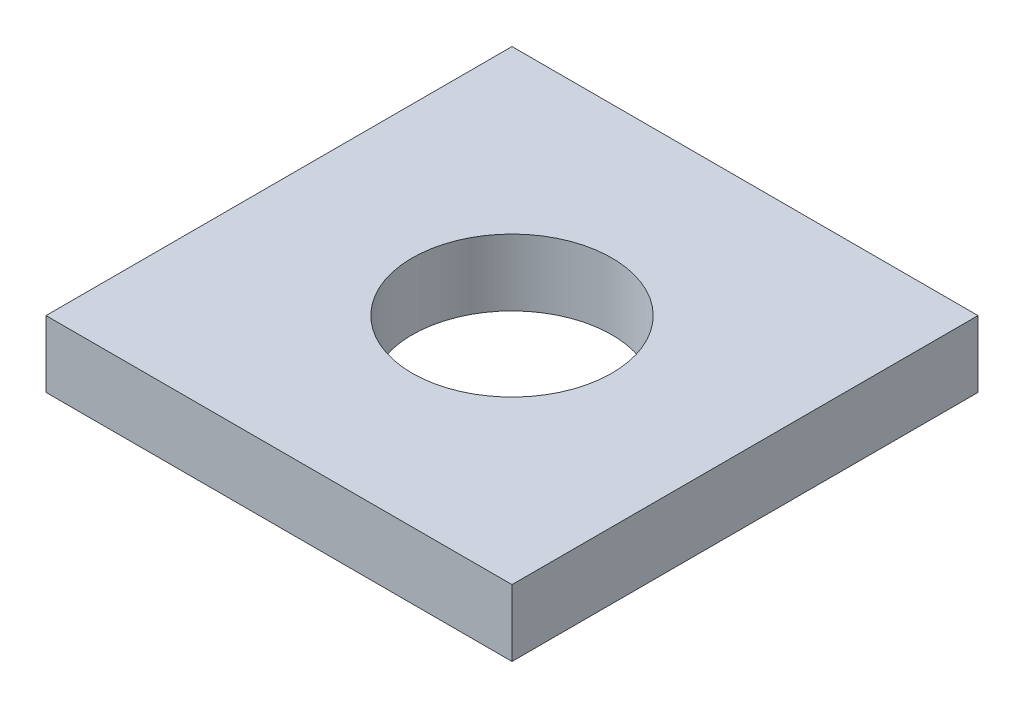
from build123d import *

# Parameters (mm, degrees)
SKETCH_1_W      = 7
SKETCH_1_H      = 7
SKETCH_1_R      = 1.5
EXTRUDE_1_DEPTH = 1


with BuildPart() as part:
    # 草图1 → 凸台-拉伸1 (new body)
    with BuildSketch(Plane(origin=(0, 0, 0), x_dir=(1, 0, 0), z_dir=(0, 1, 0))):
        Rectangle(SKETCH_1_W, SKETCH_1_H)
        Circle(SKETCH_1_R, mode=Mode.SUBTRACT)
    extrude(amount=EXTRUDE_1_DEPTH)


solid = part.part
